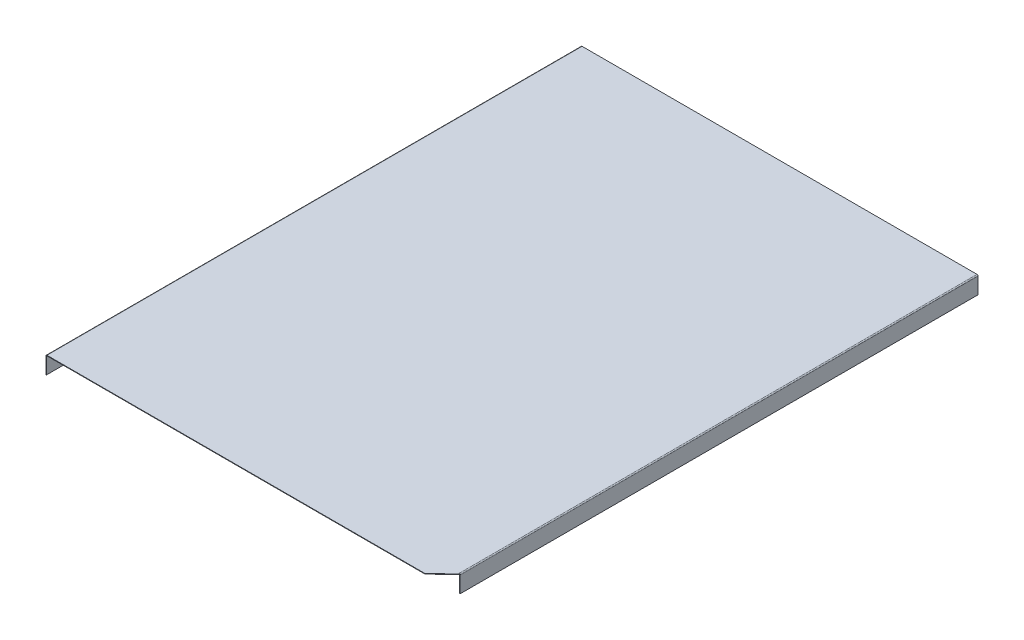
from build123d import *

# Parameters (mm, degrees)
SKETCH1_W                      = 947.4
SKETCH1_H                      = 1277.4
BASE_FLANGE1_DEPTH             = 1.2
CUT_EXTRUDE1_DEPTH             = 10
EDGE_FLANGE1_STRIP_W           = 7.2
EDGE_FLANGE1_STRIP_H           = 1.2
EDGE_FLANGE1_STRIP_CUT_DEPTH   = 1236.2
EDGE_FLANGE1_STRIP_2_W         = 7.2
EDGE_FLANGE1_STRIP_2_H         = 1.2
EDGE_FLANGE1_STRIP_CUT_2_DEPTH = 1277.4
EDGE_FLANGE1_DEPTH             = 1236.2
EDGE_FLANGE1_BEND_DEPTH        = 1277.4


# Sheet-metal steps are written as plain solids
with BuildPart() as part:
    # Sketch1 → Base-Flange1 (new body)
    with BuildSketch(Plane(origin=(0, 0, 0), x_dir=(1, 0, 0), z_dir=(0, 1, 0))):
        Rectangle(SKETCH1_W, SKETCH1_H)
    extrude(amount=-BASE_FLANGE1_DEPTH)

    # Sketch3 → Cut-Extrude1 (cut)
    with BuildSketch(Plane.XZ.offset(1.2)):
        Polygon((431.3, 638.7), (512.405547978, 658.605547978), (473.7, 597.5), align=None)
    extrude(amount=-CUT_EXTRUDE1_DEPTH, mode=Mode.SUBTRACT)

    # Edge-Flange1 strip (across the edge) → Edge-Flange1 strip cut (cut)
    with BuildSketch(Plane(origin=(473.7, -1.2, -638.7), x_dir=(-1, 0, 0), z_dir=(0, 0, 1))):
        with Locations((-1.2, -0.6)):
            Rectangle(EDGE_FLANGE1_STRIP_W, EDGE_FLANGE1_STRIP_H)
    extrude(amount=EDGE_FLANGE1_STRIP_CUT_DEPTH, mode=Mode.SUBTRACT)

    # Edge-Flange1 strip 2 (across the edge) → Edge-Flange1 strip cut 2 (cut)
    with BuildSketch(Plane(origin=(-473.7, -1.2, 638.7), x_dir=(1, 0, 0), z_dir=(0, 0, -1))):
        with Locations((-1.2, -0.6)):
            Rectangle(EDGE_FLANGE1_STRIP_2_W, EDGE_FLANGE1_STRIP_2_H)
    extrude(amount=EDGE_FLANGE1_STRIP_CUT_2_DEPTH, mode=Mode.SUBTRACT)

    # Edge-Flange1 section (across the edge) → Edge-Flange1 (add)
    with BuildSketch(Plane(origin=(473.7, -1.2, -638.7), x_dir=(-1, 0, 0), z_dir=(0, 0, 1))):
        with BuildLine():
            Line((0, 1.2), (0, 40))
            Line((0, 40), (1.2, 40))
            Line((1.2, 40), (1.2, 1.2))
            ThreePointArc((1.2, 1.2), (1.551471863, 0.351471863), (2.4, 0))
            Line((2.4, 0), (2.4, -1.2))
            ThreePointArc((2.4, -1.2), (0.702943725, -0.497056275), (0, 1.2))
        make_face()
    extrude(amount=EDGE_FLANGE1_DEPTH)

    # Edge-Flange1 section 2 (across the edge) → Edge-Flange1 bend (add)
    with BuildSketch(Plane(origin=(-473.7, -1.2, 638.7), x_dir=(1, 0, 0), z_dir=(0, 0, -1))):
        with BuildLine():
            Line((0, 1.2), (0, 40))
            Line((0, 40), (1.2, 40))
            Line((1.2, 40), (1.2, 1.2))
            ThreePointArc((1.2, 1.2), (1.551471863, 0.351471863), (2.4, 0))
            Line((2.4, 0), (2.4, -1.2))
            ThreePointArc((2.4, -1.2), (0.702943725, -0.497056275), (0, 1.2))
        make_face()
    extrude(amount=EDGE_FLANGE1_BEND_DEPTH)


solid = part.part
